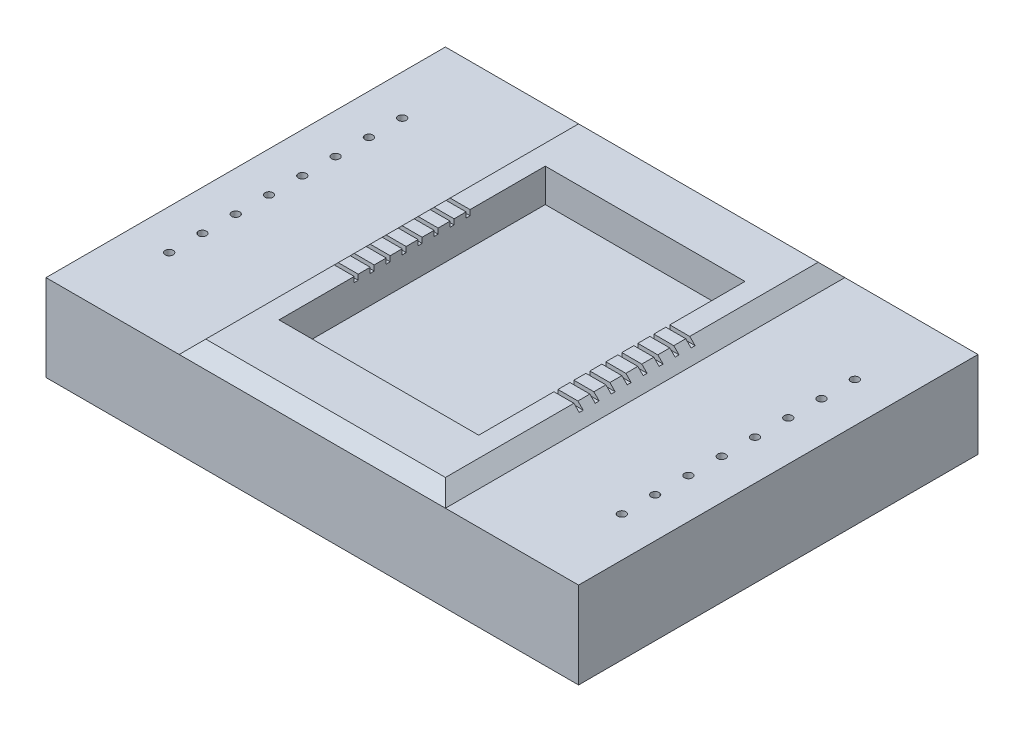
from build123d import *

# Parameters (mm, degrees)
SKETCH1_W               = 101.6
SKETCH1_H               = 76.2
BOSS_EXTRUDE1_DEPTH     = 19.05
SKETCH2_W               = 38.1
SKETCH2_H               = 50.8
CUT_EXTRUDE1_DEPTH      = 6.35
SKETCH3_W               = 25.4
SKETCH3_H               = 2.54
CUT_EXTRUDE2_DEPTH      = 94.541341128
CHAMFER1_SIZE           = 2.54
SKETCH4_R               = 0.762
CUT_EXTRUDE3_DEPTH      = 6.35
LPATTERN1_COUNT         = 8
LPATTERN1_PITCH         = 6.35
MIRROR1_COPY_1_SKETCH_R = 0.762
MIRROR1_COPY_1_DEPTH    = 6.35
MIRROR1_COPY_2_SKETCH_R = 0.762
MIRROR1_COPY_2_DEPTH    = 6.35
MIRROR1_COPY_3_SKETCH_R = 0.762
MIRROR1_COPY_3_DEPTH    = 6.35
MIRROR1_COPY_4_SKETCH_R = 0.762
MIRROR1_COPY_4_DEPTH    = 6.35
MIRROR1_COPY_5_SKETCH_R = 0.762
MIRROR1_COPY_5_DEPTH    = 6.35
MIRROR1_COPY_6_SKETCH_R = 0.762
MIRROR1_COPY_6_DEPTH    = 6.35
MIRROR1_COPY_7_SKETCH_R = 0.762
MIRROR1_COPY_7_DEPTH    = 6.35
SKETCH6_W               = 0.762
SKETCH6_H               = 1.016
CUT_EXTRUDE8_DEPTH      = 111.168382488
LPATTERN2_COUNT         = 8
LPATTERN2_PITCH         = 3.048


with BuildPart() as part:
    # Sketch1 → Boss-Extrude1 (new body)
    with BuildSketch(Plane(origin=(0, 0, 0), x_dir=(1, 0, 0), z_dir=(0, 1, 0))):
        Rectangle(SKETCH1_W, SKETCH1_H)
    extrude(amount=BOSS_EXTRUDE1_DEPTH)

    # Sketch2 → Cut-Extrude1 (cut)
    with BuildSketch(Plane(origin=(0, 19.05, 0), x_dir=(1, 0, 0), z_dir=(0, 1, 0))):
        Rectangle(SKETCH2_W, SKETCH2_H)
    extrude(amount=-CUT_EXTRUDE1_DEPTH, mode=Mode.SUBTRACT)

    # Sketch3 → Cut-Extrude2 (cut, through all)
    with BuildSketch(Plane.XY.offset(38.1)):
        with Locations((-38.1, 17.78)):
            Rectangle(SKETCH3_W, SKETCH3_H)
        with Locations((38.1, 17.78)):
            Rectangle(SKETCH3_W, SKETCH3_H)
    extrude(amount=-CUT_EXTRUDE2_DEPTH, mode=Mode.SUBTRACT)

    # Chamfer1
    chamfer1_edges = [part.edges().sort_by_distance(p)[0] for p in [
        (25.4, 19.05, 0),
        (-25.4, 19.05, 0),
        (0, 19.05, -38.1),
        (0, 19.05, 38.1),
    ]]
    chamfer(chamfer1_edges, length=CHAMFER1_SIZE - 0.0001)  # a hair under: the kernel refuses the full size

    # Sketch4 → Cut-Extrude3 (cut)
    with BuildSketch(Plane(origin=(0, 16.51, 0), x_dir=(1, 0, 0), z_dir=(0, 1, 0))):
        with Locations(Location((-43.18, 22.225, 0), (0, 0, 270))):
            Circle(SKETCH4_R)
    cut_extrude3 = extrude(amount=-CUT_EXTRUDE3_DEPTH, mode=Mode.SUBTRACT)

    # LPattern1: Cut-Extrude3 ×8
    with Locations(*[(0, 0, i * LPATTERN1_PITCH) for i in range(1, LPATTERN1_COUNT)]):
        add(cut_extrude3, mode=Mode.SUBTRACT)

    # Mirror1: Cut-Extrude3 across plane
    add(cut_extrude3.mirror(Plane(origin=(0, 0, 0), x_dir=(0, 0, 1), z_dir=(1, 0, 0))), mode=Mode.SUBTRACT)

    # Mirror1 copy 1 sketch → Mirror1 copy 1 (cut)
    with BuildSketch(Plane(origin=(0, 16.51, 6.35), x_dir=(-1, 0, 0), z_dir=(0, 1, 0))):
        with Locations((-43.18, -22.225)):
            Circle(MIRROR1_COPY_1_SKETCH_R)
    extrude(amount=-MIRROR1_COPY_1_DEPTH, mode=Mode.SUBTRACT)

    # Mirror1 copy 2 sketch → Mirror1 copy 2 (cut)
    with BuildSketch(Plane(origin=(0, 16.51, 12.7), x_dir=(-1, 0, 0), z_dir=(0, 1, 0))):
        with Locations((-43.18, -22.225)):
            Circle(MIRROR1_COPY_2_SKETCH_R)
    extrude(amount=-MIRROR1_COPY_2_DEPTH, mode=Mode.SUBTRACT)

    # Mirror1 copy 3 sketch → Mirror1 copy 3 (cut)
    with BuildSketch(Plane(origin=(0, 16.51, 19.05), x_dir=(-1, 0, 0), z_dir=(0, 1, 0))):
        with Locations((-43.18, -22.225)):
            Circle(MIRROR1_COPY_3_SKETCH_R)
    extrude(amount=-MIRROR1_COPY_3_DEPTH, mode=Mode.SUBTRACT)

    # Mirror1 copy 4 sketch → Mirror1 copy 4 (cut)
    with BuildSketch(Plane(origin=(0, 16.51, 25.4), x_dir=(-1, 0, 0), z_dir=(0, 1, 0))):
        with Locations((-43.18, -22.225)):
            Circle(MIRROR1_COPY_4_SKETCH_R)
    extrude(amount=-MIRROR1_COPY_4_DEPTH, mode=Mode.SUBTRACT)

    # Mirror1 copy 5 sketch → Mirror1 copy 5 (cut)
    with BuildSketch(Plane(origin=(0, 16.51, 31.75), x_dir=(-1, 0, 0), z_dir=(0, 1, 0))):
        with Locations((-43.18, -22.225)):
            Circle(MIRROR1_COPY_5_SKETCH_R)
    extrude(amount=-MIRROR1_COPY_5_DEPTH, mode=Mode.SUBTRACT)

    # Mirror1 copy 6 sketch → Mirror1 copy 6 (cut)
    with BuildSketch(Plane(origin=(0, 16.51, 38.1), x_dir=(-1, 0, 0), z_dir=(0, 1, 0))):
        with Locations((-43.18, -22.225)):
            Circle(MIRROR1_COPY_6_SKETCH_R)
    extrude(amount=-MIRROR1_COPY_6_DEPTH, mode=Mode.SUBTRACT)

    # Mirror1 copy 7 sketch → Mirror1 copy 7 (cut)
    with BuildSketch(Plane(origin=(0, 16.51, 44.45), x_dir=(-1, 0, 0), z_dir=(0, 1, 0))):
        with Locations((-43.18, -22.225)):
            Circle(MIRROR1_COPY_7_SKETCH_R)
    extrude(amount=-MIRROR1_COPY_7_DEPTH, mode=Mode.SUBTRACT)

    # Sketch6 → Cut-Extrude8 (cut, through all)
    with BuildSketch(Plane.ZY.offset(50.8)):
        with Locations((-10.668, 18.542)):
            Rectangle(SKETCH6_W, SKETCH6_H)
    cut_extrude8 = extrude(amount=-CUT_EXTRUDE8_DEPTH, mode=Mode.SUBTRACT)

    # LPattern2: Cut-Extrude8 ×8
    with Locations(*[(0, 0, i * LPATTERN2_PITCH) for i in range(1, LPATTERN2_COUNT)]):
        add(cut_extrude8, mode=Mode.SUBTRACT)


solid = part.part
